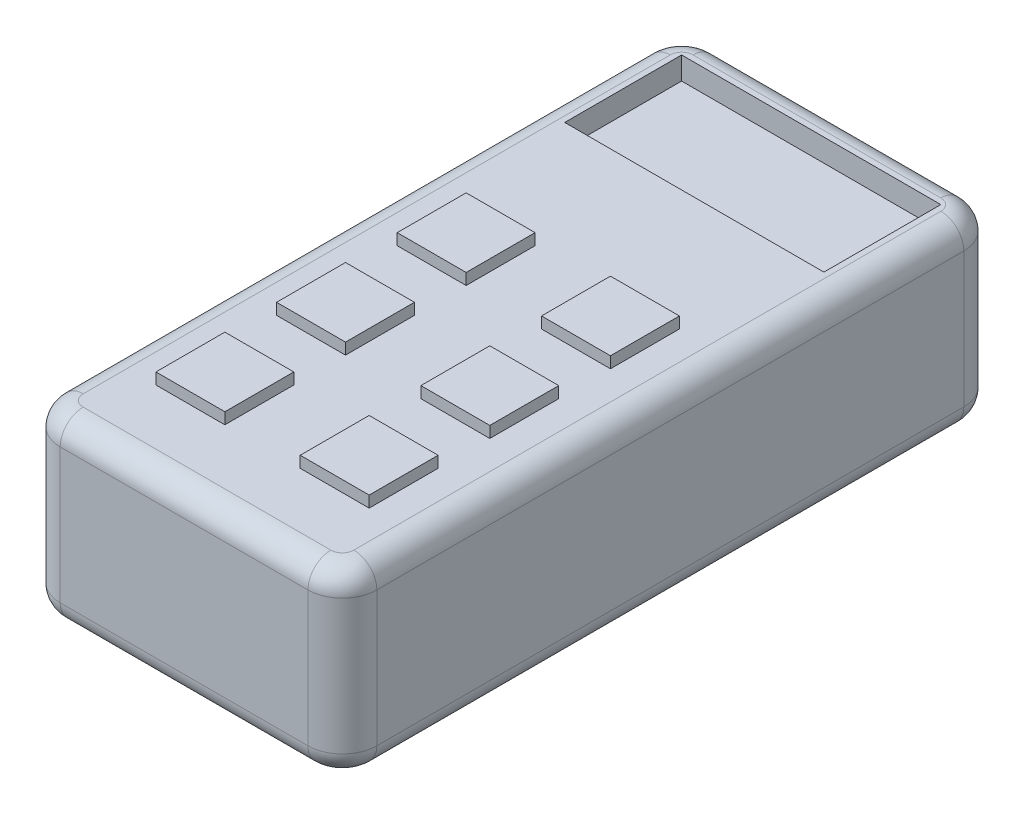
from build123d import *

# Parameters (mm, degrees)
SKETCH1_W           = 70
SKETCH1_H           = 145
BOSS_EXTRUDE1_DEPTH = 40
SKETCH2_W           = 57.3
SKETCH2_H           = 25.847658175
CUT_EXTRUDE1_DEPTH  = 5
SKETCH3_W           = 15.24
SKETCH3_H           = 15.24
BOSS_EXTRUDE2_DEPTH = 2.5
LPATTERN1_COUNT     = 3
LPATTERN1_PITCH     = 26.67
FILLET1_R           = 7.62
FILLET2_R           = 5.08
FILLET3_R           = 5.08


with BuildPart() as part:
    # Sketch1 → Boss-Extrude1 (new body)
    with BuildSketch(Plane(origin=(0, 0, 0), x_dir=(1, 0, 0), z_dir=(0, 1, 0))):
        Rectangle(SKETCH1_W, SKETCH1_H)
    extrude(amount=BOSS_EXTRUDE1_DEPTH)

    # Sketch2 → Cut-Extrude1 (cut)
    with BuildSketch(Plane(origin=(0, 40, 0), x_dir=(1, 0, 0), z_dir=(0, 1, 0))):
        with Locations((0, 53.226170913)):
            Rectangle(SKETCH2_W, SKETCH2_H)
    extrude(amount=-CUT_EXTRUDE1_DEPTH, mode=Mode.SUBTRACT)

    # Sketch3 → Boss-Extrude2 (add)
    with BuildSketch(Plane(origin=(0, 40, 0), x_dir=(1, 0, 0), z_dir=(0, 1, 0))):
        with Locations((-15.95, 5.814113942)):
            Rectangle(SKETCH3_W, SKETCH3_H)
        with Locations((15.95, 5.814113942)):
            Rectangle(SKETCH3_W, SKETCH3_H)
    boss_extrude2 = extrude(amount=BOSS_EXTRUDE2_DEPTH)

    # LPattern1: Boss-Extrude2 ×3
    with Locations(*[(0, 0, i * LPATTERN1_PITCH) for i in range(1, LPATTERN1_COUNT)]):
        add(boss_extrude2)

    # Fillet1
    fillet1_edges = [part.edges().sort_by_distance(p)[0] for p in [
        (35, 20, 72.5),
        (-35, 20, 72.5),
        (-35, 20, -72.5),
        (35, 20, -72.5),
    ]]
    fillet(fillet1_edges, radius=FILLET1_R)

    # Fillet2
    fillet2_edges = [part.edges().sort_by_distance(p)[0] for p in [
        (-32.768153673, 40, 70.268153673),
        (-35, 40, 0),
        (-32.768153673, 40, -70.268153673),
        (0, 40, -72.5),
        (32.768153673, 40, -70.268153673),
        (35, 40, 0),
        (32.768153673, 40, 70.268153673),
        (0, 40, 72.5),
    ]]
    fillet(fillet2_edges, radius=FILLET2_R)

    # Fillet3
    fillet3_edges = [part.edges().sort_by_distance(p)[0] for p in [
        (32.768153673, 0, 70.268153673),
        (0, 0, 72.5),
        (-32.768153673, 0, 70.268153673),
        (-35, 0, 0),
        (-32.768153673, 0, -70.268153673),
        (0, 0, -72.5),
        (32.768153673, 0, -70.268153673),
        (35, 0, 0),
    ]]
    fillet(fillet3_edges, radius=FILLET3_R)


solid = part.part
